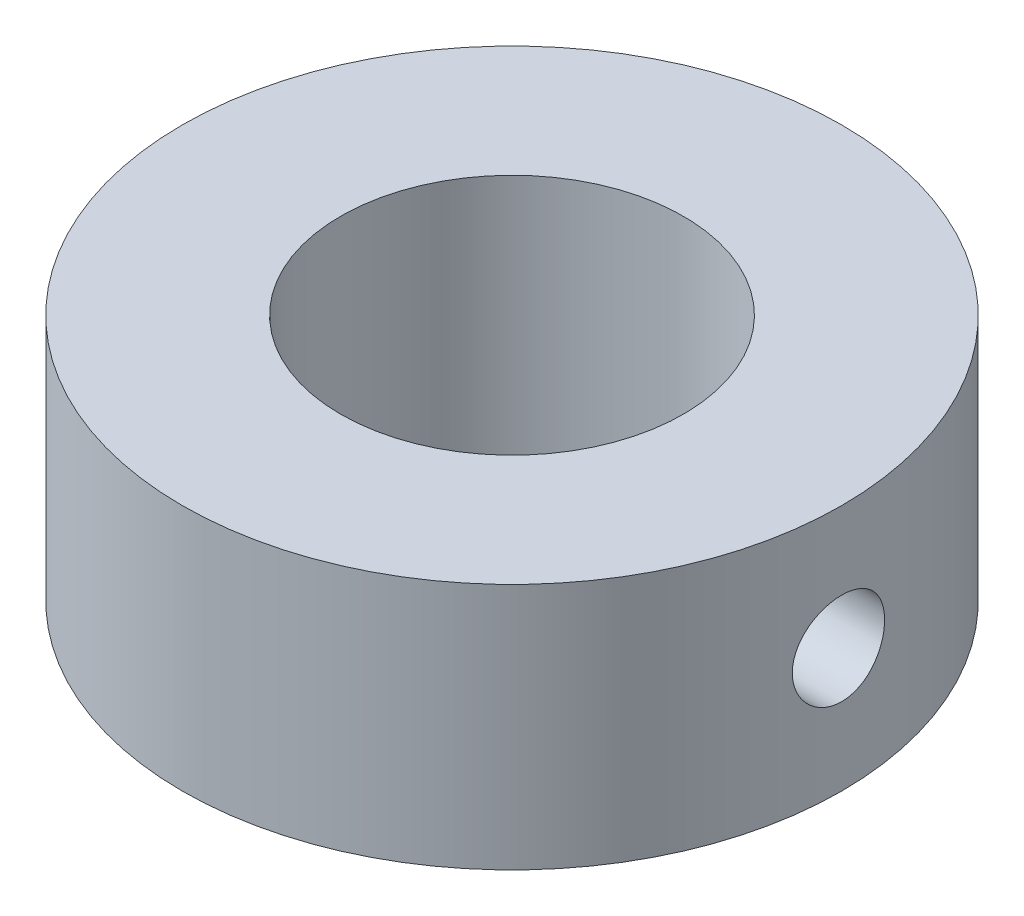
from build123d import *

# Parameters (mm, degrees)
SKETCH1_R           = 6.35
SKETCH1_R_2         = 3.302
BOSS_EXTRUDE1_DEPTH = 4.7625
SKETCH3_W           = 0.889
SKETCH3_H           = 6.35


with BuildPart() as part:
    # Sketch1 → Boss-Extrude1 (new body)
    with BuildSketch(Plane(origin=(0, 0, 0), x_dir=(1, 0, 0), z_dir=(0, 1, 0))):
        Circle(SKETCH1_R)
        Circle(SKETCH1_R_2, mode=Mode.SUBTRACT)
    extrude(amount=BOSS_EXTRUDE1_DEPTH)

    # Sketch3 → #2-64 Tapped Hole1 (revolve, cut)
    with BuildSketch(Plane.ZX.offset(2.38125)):
        with Locations((0.4445, 3.175)):
            Rectangle(SKETCH3_W, SKETCH3_H)
    revolve(axis=Axis((-6.35, 2.38125, 0), (1, 0, 0)), mode=Mode.SUBTRACT)


solid = part.part
